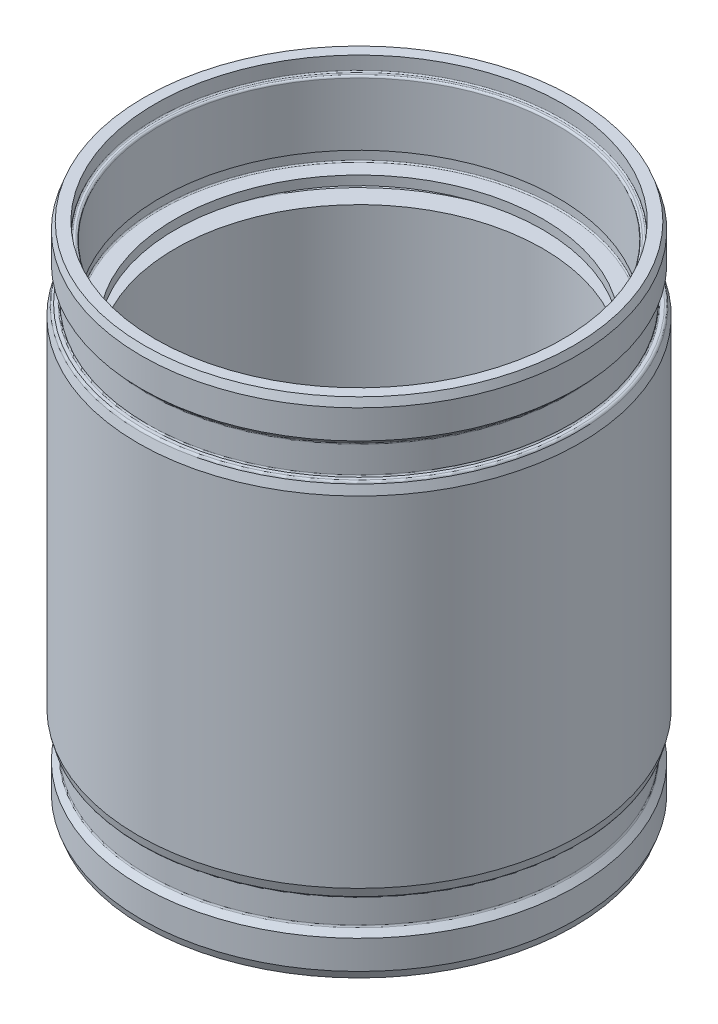
from build123d import *

# Parameters (mm, degrees)
SKETCH3_R           = 1.5
CUT_EXTRUDE2_DEPTH  = 126.898381754
EXTRUDE1_DEPTH      = 126.898381754
EXTRUDE1_DEPTH_BACK = 126.898381754
SKETCH8_R           = 6


with BuildPart() as part:
    # Sketch1 → Revolve1 (revolve)
    with BuildSketch(Plane.XY):
        with BuildLine():
            Line((69.660254038, 0), (62.5, 0))
            Line((62.5, 0), (61, -1.5))
            Line((61, -1.5), (61, -34))
            Line((61, -34), (60.265192379, -35.272724134))
            ThreePointArc((60.265192379, -35.272724134), (60.235222252, -35.34507842), (60.225, -35.422724134))
            Line((60.225, -35.422724134), (60.225, -38.35))
            ThreePointArc((60.225, -38.35), (60.312867966, -38.562132034), (60.525, -38.65))
            Line((60.525, -38.65), (67.15, -38.65))
            ThreePointArc((67.15, -38.65), (67.432842712, -38.767157288), (67.55, -39.05))
            Line((67.55, -39.05), (67.55, -44.55))
            ThreePointArc((67.55, -44.55), (67.432842712, -44.832842712), (67.15, -44.95))
            Line((67.15, -44.95), (60.315, -44.95))
            ThreePointArc((60.315, -44.95), (60.102867966, -45.037867966), (60.015, -45.25))
            Line((60.015, -45.25), (60.015, -47.45))
            Line((60.015, -47.45), (60.015, -51.708380151))
            ThreePointArc((60.015, -51.708380151), (60.515, -52.45), (60.015, -53.191619849))
            Line((60.015, -53.191619849), (60.015, -59.708380151))
            ThreePointArc((60.015, -59.708380151), (60.515, -60.45), (60.015, -61.191619849))
            Line((60.015, -61.191619849), (60.015, -75.7))
            Line((60.015, -75.7), (60.265, -75.95))
            Line((60.265, -75.95), (68.896955762, -75.95))
            ThreePointArc((68.896955762, -75.95), (69.183743981, -75.859576022), (69.366802073, -75.621010072))
            Line((69.366802073, -75.621010072), (69.975, -73.95))
            Line((69.975, -73.95), (69.975, -71.4))
            ThreePointArc((69.975, -71.4), (69.901776695, -71.223223305), (69.725, -71.15))
            Line((69.725, -71.15), (67.9, -71.15))
            ThreePointArc((67.9, -71.15), (67.617157288, -71.032842712), (67.5, -70.75))
            Line((67.5, -70.75), (67.5, -67.75))
            ThreePointArc((67.5, -67.75), (67.617157288, -67.467157288), (67.9, -67.35))
            Line((67.9, -67.35), (69.725, -67.35))
            ThreePointArc((69.725, -67.35), (69.901776695, -67.276776695), (69.975, -67.1))
            Line((69.975, -67.1), (69.975, -64.95))
            Line((69.975, -64.95), (68.234314575, -63.209314575))
            ThreePointArc((68.234314575, -63.209314575), (68.060896374, -62.949775896), (68, -62.64362915))
            Line((68, -62.64362915), (68, -53.75))
            ThreePointArc((68, -53.75), (68.234314575, -53.184314575), (68.8, -52.95))
            Line((68.8, -52.95), (69.965954326, -52.95))
            ThreePointArc((69.965954326, -52.95), (70.148582755, -52.888006002), (70.255732074, -52.727645714))
            Line((70.255732074, -52.727645714), (71, -49.95))
            Line((71, -49.95), (71, -32.05))
            ThreePointArc((71, -32.05), (70.912132034, -31.837867966), (70.7, -31.75))
            Line((70.7, -31.75), (68.9, -31.75))
            ThreePointArc((68.9, -31.75), (68.617157288, -31.632842712), (68.5, -31.35))
            Line((68.5, -31.35), (68.5, -28.35))
            ThreePointArc((68.5, -28.35), (68.617157288, -28.067157288), (68.9, -27.95))
            Line((68.9, -27.95), (70.7, -27.95))
            ThreePointArc((70.7, -27.95), (70.912132034, -27.862132034), (71, -27.65))
            Line((71, -27.65), (71, -24.429919354))
            ThreePointArc((71, -24.429919354), (70.95669604, -24.274654603), (70.839285714, -24.164213709))
            ThreePointArc((70.839285714, -24.164213709), (69.5, -21.95), (70.839285714, -19.735786291))
            ThreePointArc((70.839285714, -19.735786291), (70.95669604, -19.625345397), (71, -19.470080646))
            Line((71, -19.470080646), (71, -14.05))
            ThreePointArc((71, -14.05), (70.912132034, -13.837867966), (70.7, -13.75))
            Line((70.7, -13.75), (68.9, -13.75))
            ThreePointArc((68.9, -13.75), (68.617157288, -13.632842712), (68.5, -13.35))
            Line((68.5, -13.35), (68.5, -10.35))
            ThreePointArc((68.5, -10.35), (68.617157288, -10.067157288), (68.9, -9.95))
            Line((68.9, -9.95), (70.7, -9.95))
            ThreePointArc((70.7, -9.95), (70.912132034, -9.862132034), (71, -9.65))
            Line((71, -9.65), (71, -5))
            Line((71, -5), (69.660254038, 0))
        make_face()
    revolve(axis=Axis((0, 0, 0), (0, -1, 0)))

    # Sketch3 → Cut-Extrude2 (cut, through all)
    with BuildSketch(Plane.XY):
        with Locations((0, -21.95)):
            Circle(SKETCH3_R)
    extrude(amount=CUT_EXTRUDE2_DEPTH, mode=Mode.SUBTRACT)

    # Sketch8 → Extrude1 (cut, two sides: drawn at the far end of the back side and taken through both)
    with BuildSketch(Plane.XY.offset(-EXTRUDE1_DEPTH_BACK)):
        with Locations((0, 4.5)):
            Circle(SKETCH8_R)
    extrude(amount=EXTRUDE1_DEPTH + EXTRUDE1_DEPTH_BACK, mode=Mode.SUBTRACT)

    # Sketch13 → Revolve2 (revolve)
    with BuildSketch(Plane.XY):
        with BuildLine():
            Line((59.5, -47.45), (59.5, -76.5))
            Line((59.5, -76.5), (69.578964789, -76.5))
            Line((69.578964789, -76.5), (70.475, -74.03816349))
            Line((70.475, -74.03816349), (70.475, -66.7))
            Line((70.475, -66.7), (70.475, -64.742893219))
            Line((70.475, -64.742893219), (68.734314575, -63.002207794))
            ThreePointArc((68.734314575, -63.002207794), (68.560896374, -62.742669115), (68.5, -62.436522369))
            Line((68.5, -62.436522369), (68.5, -53.85))
            ThreePointArc((68.5, -53.85), (68.617157288, -53.567157288), (68.9, -53.45))
            Line((68.9, -53.45), (69.965954326, -53.45))
            ThreePointArc((69.965954326, -53.45), (70.45296347, -53.284682672), (70.738694987, -52.857055236))
            Line((70.738694987, -52.857055236), (71.5, -50.015826249))
            Line((71.5, -50.015826249), (71.5, 0))
            Line((71.5, 0), (71.5, 60.015826249))
            Line((71.5, 60.015826249), (70.738694987, 62.857055236))
            ThreePointArc((70.738694987, 62.857055236), (70.45296347, 63.284682672), (69.965954326, 63.45))
            Line((69.965954326, 63.45), (68.9, 63.45))
            ThreePointArc((68.9, 63.45), (68.617157288, 63.567157288), (68.5, 63.85))
            Line((68.5, 63.85), (68.5, 72.436522369))
            ThreePointArc((68.5, 72.436522369), (68.560896374, 72.742669115), (68.734314575, 73.002207794))
            Line((68.734314575, 73.002207794), (70.475, 74.742893219))
            Line((70.475, 74.742893219), (70.475, 76.7))
            Line((70.475, 76.7), (70.475, 84.03816349))
            Line((70.475, 84.03816349), (69.578964789, 86.5))
            Line((69.578964789, 86.5), (59.5, 86.5))
            Line((59.5, 86.5), (59.5, 54.45))
            Line((59.5, 54.45), (66.25, 54.45))
            ThreePointArc((66.25, 54.45), (66.815685425, 54.215685425), (67.05, 53.65))
            Line((67.05, 53.65), (67.05, 49.95))
            ThreePointArc((67.05, 49.95), (66.815685425, 49.384314575), (66.25, 49.15))
            Line((66.25, 49.15), (59.5, 49.15))
            Line((59.5, 49.15), (59.5, -39.15))
            Line((59.5, -39.15), (66.25, -39.15))
            ThreePointArc((66.25, -39.15), (66.815685425, -39.384314575), (67.05, -39.95))
            Line((67.05, -39.95), (67.05, -43.65))
            ThreePointArc((67.05, -43.65), (66.815685425, -44.215685425), (66.25, -44.45))
            Line((66.25, -44.45), (59.5, -44.45))
            Line((59.5, -44.45), (59.5, -47.45))
        make_face()
    revolve(axis=Axis((0, 0, 0), (0, -1, 0)))

    # Sketch14 → Cut-Revolve1 (revolve, cut)
    with BuildSketch(Plane.XY):
        with BuildLine():
            Line((64.9, -71.85), (65.6, -71.85))
            ThreePointArc((65.6, -71.85), (65.882842712, -71.967157288), (66, -72.25))
            Line((66, -72.25), (66, -76.5))
            Line((66, -76.5), (58.8156371, -76.5))
            Line((58.8156371, -76.5), (58.8156371, -47.45))
            Line((58.8156371, -47.45), (64.5, -47.45))
            ThreePointArc((64.5, -47.45), (64.782842712, -47.567157288), (64.9, -47.85))
            Line((64.9, -47.85), (64.9, -51))
            Line((64.9, -51), (64.3, -51))
            Line((64.3, -51), (64.3, -60.95))
            Line((64.3, -60.95), (64.3, -64.5))
            Line((64.3, -64.5), (64.3, -71.25))
            ThreePointArc((64.3, -71.25), (64.475735931, -71.674264069), (64.9, -71.85))
        make_face()
        with BuildLine():
            Line((64.9, 61), (64.9, 57.85))
            ThreePointArc((64.9, 57.85), (64.782842712, 57.567157288), (64.5, 57.45))
            Line((64.5, 57.45), (58.8156371, 57.45))
            Line((58.8156371, 57.45), (58.8156371, 86.5))
            Line((58.8156371, 86.5), (66, 86.5))
            Line((66, 86.5), (66, 82.25))
            ThreePointArc((66, 82.25), (65.882842712, 81.967157288), (65.6, 81.85))
            Line((65.6, 81.85), (64.9, 81.85))
            ThreePointArc((64.9, 81.85), (64.475735931, 81.674264069), (64.3, 81.25))
            Line((64.3, 81.25), (64.3, 74.5))
            Line((64.3, 74.5), (64.3, 70.95))
            Line((64.3, 70.95), (64.3, 61))
            Line((64.3, 61), (64.9, 61))
        make_face()
    revolve(axis=Axis((0, 0, 0), (0, -1, 0)), mode=Mode.SUBTRACT)


solid = part.part
